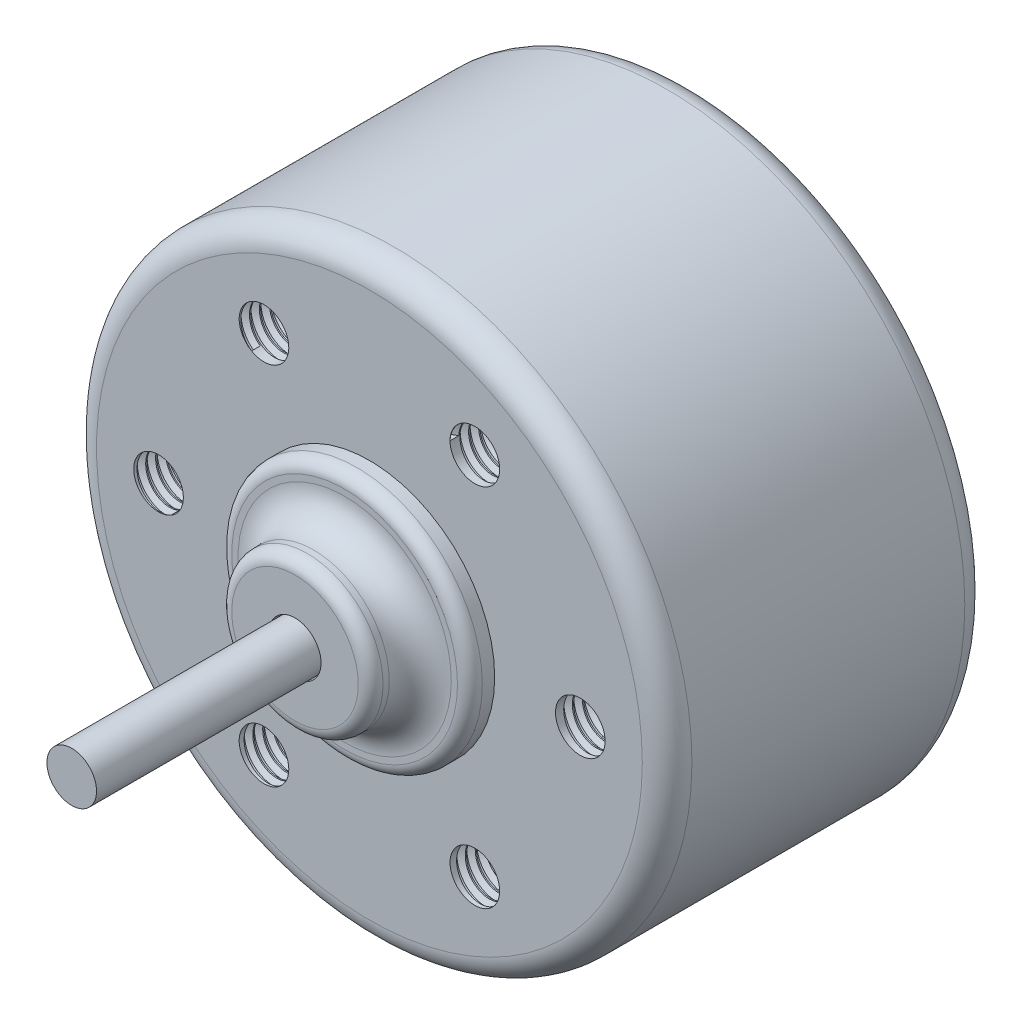
from build123d import *

# Parameters (mm, degrees)
SKETCH1_R         = 12
HOUSING_DEPTH     = 6.5
SKETCH2_R         = 1
SHAFT_DEPTH       = 12
FILLET1_R         = 1
THREAD2_PITCH     = 0.4
CIRPATTERN1_COUNT = 6


with BuildPart() as part:
    # Sketch1 → Housing (new, symmetric)
    with BuildSketch(Plane.XY):
        with Locations(Location((0, 0, 0), (0, 0, 180))):
            Circle(SKETCH1_R)
    extrude(amount=HOUSING_DEPTH, both=True)

    # Sketch2 → Shaft (add)
    with BuildSketch(Plane.XY.offset(6.5)):
        Circle(SKETCH2_R)
    extrude(amount=SHAFT_DEPTH)

    # Fillet1
    fillet1_edges = [part.edges().sort_by_distance(p)[0] for p in [
        (12, 0, -6.5),
        (12, 0, 6.5),
    ]]
    fillet(fillet1_edges, radius=FILLET1_R)

    # Sketch16 → ShaftSupport (revolve)
    with BuildSketch(Plane(origin=(0, 0, 0), x_dir=(1, 0, 0), z_dir=(0, 1, 0)), mode=Mode.PRIVATE) as shaftsupport_sk:
        with BuildLine():
            Line((-5.05, -6.5), (-1.05, -6.5))
            Line((-1.05, -6.5), (-1.05, -9.5))
            Line((-1.05, -9.5), (-2.55, -9.5))
            ThreePointArc((-2.55, -9.5), (-2.903553391, -9.353553391), (-3.05, -9))
            Line((-3.05, -9), (-3.05, -8.75))
            ThreePointArc((-3.05, -8.75), (-3.416116524, -7.866116524), (-4.3, -7.5))
            Line((-4.3, -7.5), (-4.55, -7.5))
            ThreePointArc((-4.55, -7.5), (-4.903553391, -7.353553391), (-5.05, -7))
            Line((-5.05, -7), (-5.05, -6.5))
        make_face()
    revolve(shaftsupport_sk.sketch.rotate(Axis((0, 0, 19.352935774), (0, 0, -1)), 180), axis=Axis((0, 0, 19.352935774), (0, 0, -1)))

    # Sketch12 → Ø2.0mm Dowel Hole4 (revolve, cut)
    with BuildSketch(Plane(origin=(4.25, 7.361215932, 6.5), x_dir=(0, -1, 0), z_dir=(1, 0, 0))):
        Polygon((0, 0), (0, 6.600860619), (1, 6), (1, 0), align=None)
    f_2_0mm_dowel_hole4 = revolve(axis=Axis((4.25, 7.361215932, 12.85), (0, 0, -1)), mode=Mode.SUBTRACT)

    # Thread2: the profile of Thread Profile2 profile screwed along a right-hand helix of 11.5 turns, 6 arcs to a turn; built about Z, then put on its axis
    thread2_z = Axis((0, 0, 0), (0, 0, 1))
    thread2_corners = [(0.9997, 0, 0.350173206), (0.9997, 0, -0.000173205), (1.216506352, 0, 0.125000001), (1.216506352, 0, 0.225000001)]
    with BuildLine(mode=Mode.PRIVATE) as thread2_profile:
        Line(thread2_corners[0], thread2_corners[1])
        Line(thread2_corners[1], thread2_corners[2])
        Line(thread2_corners[2], thread2_corners[3])
        Line(thread2_corners[3], thread2_corners[0])
    thread2_cap = Face(thread2_profile.wire())
    thread2_turn_angles = [0, 30, 60, 90, 120, 150, 180, 210, 240, 270, 300, 330, 360]
    thread2_turn_weights = [1, 0.8660254037844387, 1, 0.8660254037844387, 1, 0.8660254037844387, 1, 0.8660254037844387, 1, 0.8660254037844387, 1, 0.8660254037844387, 1]
    thread2_turn_rails = [Edge.make_bspline([Vector(p[0], p[1], 0).rotate(thread2_z, thread2_turn_angles[k]) / thread2_turn_weights[k] + Vector(0, 0, p[2] + THREAD2_PITCH * thread2_turn_angles[k] / 360) for k in range(13)], [0, 0, 0, 1, 1, 2, 2, 3, 3, 4, 4, 5, 5, 6, 6, 6], 2, thread2_turn_weights) for p in thread2_corners]
    thread2_turn_sides = [Face.make_surface_from_curves(thread2_turn_rails[p[0]], thread2_turn_rails[p[1]]) for p in [(0, 1), (1, 2), (2, 3), (3, 0)]]
    thread2_last_angles = [3960, 3990, 4020, 4050, 4080, 4110, 4140]
    thread2_last_weights = [1, 0.8660254037844387, 1, 0.8660254037844387, 1, 0.8660254037844387, 1]
    thread2_last_rails = [Edge.make_bspline([Vector(p[0], p[1], 0).rotate(thread2_z, thread2_last_angles[k]) / thread2_last_weights[k] + Vector(0, 0, p[2] + THREAD2_PITCH * thread2_last_angles[k] / 360) for k in range(7)], [0, 0, 0, 1, 1, 2, 2, 3, 3, 3], 2, thread2_last_weights) for p in thread2_corners]
    thread2_last_sides = [Face.make_surface_from_curves(thread2_last_rails[p[0]], thread2_last_rails[p[1]]) for p in [(0, 1), (1, 2), (2, 3), (3, 0)]]
    thread2 = Plane(origin=(4.25, 7.361215932, 6.5), x_dir=(-1, 0, 0), z_dir=(0, 0, -1)) * Solid(Shell([*[p.moved(Location((0, 0, THREAD2_PITCH * i))) for i in range(11) for p in thread2_turn_sides], *thread2_last_sides, thread2_cap, thread2_cap.rotate(thread2_z, 4140).moved(Location((0, 0, THREAD2_PITCH * 4140 / 360)))]))
    add(thread2, mode=Mode.SUBTRACT)

    # CirPattern1: Ø2.0mm Dowel Hole4, Thread2 ×6 about axis
    cirpattern1_axis = Axis((0, 0, 6.5), (0, 0, 1))
    add([f_2_0mm_dowel_hole4.rotate(cirpattern1_axis, i * 360 / CIRPATTERN1_COUNT) for i in range(1, CIRPATTERN1_COUNT)], mode=Mode.SUBTRACT)
    add([thread2.rotate(cirpattern1_axis, i * 360 / CIRPATTERN1_COUNT) for i in range(1, CIRPATTERN1_COUNT)], mode=Mode.SUBTRACT)


solid = part.part
